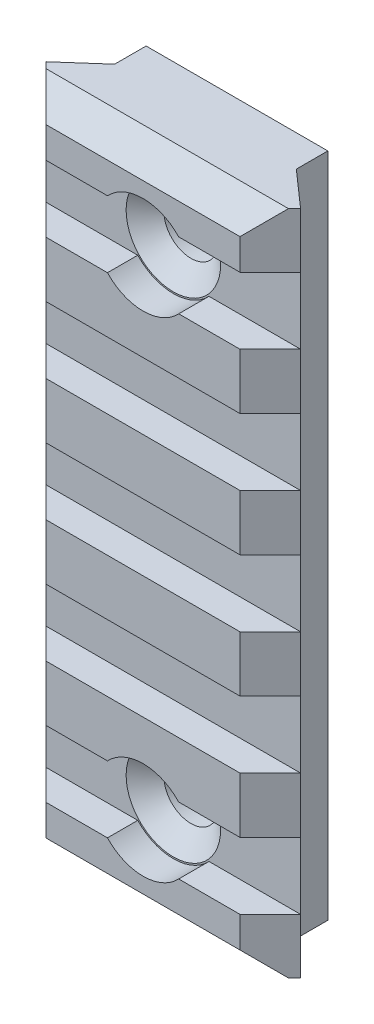
from build123d import *
from OCP.BRepAlgoAPI import BRepAlgoAPI_Cut
from OCP.TopTools import TopTools_ListOfShape

# Parameters (mm, degrees)
EXTRUDE_1_DEPTH          = 55
CUT_EXTRUDE_1_DEPTH      = 57.52709527297507
CUT_EXTRUDE_1_DEPTH_BACK = 57.52709527297507
SKETCH_2_W               = 2.5000000000000018
SKETCH_2_H               = 5.5000000000000036
SKETCH_2_H_2             = 5.499999999999993
SKETCH_2_H_3             = 5.5
CHAMFER_1_SIZE           = 2
SKETCH_3_R               = 1.8999999999999997
SKETCH_3_R_2             = 1.9000000000000001
CUT_EXTRUDE_2_DEPTH      = 57.52709527297507
SKETCH_4_R               = 4.025
CUT_EXTRUDE_3_DEPTH      = 2.5
CUT_EXTRUDE_4_DEPTH      = 3.8
EXTRUDE_START            = -1
EXTRUDE_2_DEPTH          = 1
FILLET_1_R               = 0.1


with BuildPart() as part:
    # 스케치1 → 보스-돌출1 (new body)
    with BuildSketch(Plane(origin=(0, 0, 0), x_dir=(1, 0, 0), z_dir=(0, 1, 0))):
        Polygon((-7.5, 0), (7.5, 0), (7.5, -2.5999999999999983), (10.5, -5.249999999999997), (8.000000000000002, -7.749999999999999), (-7.999999999999998, -7.750000000000001), (-10.5, -5.25), (-7.5, -2.6), align=None)
    extrude(amount=EXTRUDE_1_DEPTH)


with BuildPart() as cut_extrude_1_tool:
    # 스케치2 → 컷-돌출1 (new, two sides: drawn at the far end of the back side and taken through both)
    with BuildSketch(Plane(origin=(0, 0, 0), x_dir=(0, 0, -1), z_dir=(1, 0, 0)).offset(-CUT_EXTRUDE_1_DEPTH_BACK)):
        Polygon((-7.749999999999999, 4.549999999999999), (-5.249999999999997, 4.549999999999999), (-5.249999999999997, 10.049999999999997), (-7.749999999999999, 10.049999999999999), align=None)
        Polygon((-7.749999834765438, 20.150000000000002), (-5.249999834765436, 20.150000000000002), (-5.249999834765436, 14.649999999999999), (-7.749999834765438, 14.65), align=None)
        with Locations((-6.499999669530876, 27.5)):
            Rectangle(SKETCH_2_W, SKETCH_2_H)
        with Locations((-6.499999504296315, 37.599999999999994)):
            Rectangle(SKETCH_2_W, SKETCH_2_H_2)
        with Locations((-6.499999339061754, 47.699999999999996)):
            Rectangle(SKETCH_2_W, SKETCH_2_H_3)
    extrude(amount=CUT_EXTRUDE_1_DEPTH + CUT_EXTRUDE_1_DEPTH_BACK)


with BuildPart() as part_1:
    add(part.part)

    # 컷-돌출1: cut by cut_extrude_1_tool, with a tolerance
    cut_extrude_1_stock = TopTools_ListOfShape()
    cut_extrude_1_stock.Append(part_1.part.wrapped)
    cut_extrude_1_tools = TopTools_ListOfShape()
    cut_extrude_1_tools.Append(cut_extrude_1_tool.part.wrapped)
    cut_extrude_1_cut = BRepAlgoAPI_Cut()
    cut_extrude_1_cut.SetArguments(cut_extrude_1_stock)
    cut_extrude_1_cut.SetTools(cut_extrude_1_tools)
    cut_extrude_1_cut.SetFuzzyValue(0.00001)
    cut_extrude_1_cut.Build()
    add(Compound.cast(cut_extrude_1_cut.Shape()).solids(), mode=Mode.REPLACE)

    # 모따기1
    chamfer_1_edges = [part_1.edges().sort_by_distance(p)[0] for p in [
        (1.78e-15, 55, 7.75),
        (1.78e-15, 0, 7.75),
    ]]
    chamfer(chamfer_1_edges, length=CHAMFER_1_SIZE)

    # 스케치3 → 컷-돌출2 (cut, through all)
    with BuildSketch(Plane.XY):
        with Locations(Location((-3.47e-15, 47.699999999999996, 0), (0, 0, 180))):
            Circle(SKETCH_3_R)
        with Locations(Location((-3.47e-15, 7.299999999999997, 0), (0, 0, 180))):
            Circle(SKETCH_3_R_2)
    extrude(amount=CUT_EXTRUDE_2_DEPTH, mode=Mode.SUBTRACT)

    # 스케치4 → 컷-돌출3 (cut)
    with BuildSketch(Plane.XY.offset(7.75)):
        with Locations((-4.31e-15, 7.299999999999997)):
            Circle(SKETCH_4_R)
        with Locations((-4.31e-15, 47.699999999999996)):
            Circle(SKETCH_4_R)
    extrude(amount=-CUT_EXTRUDE_3_DEPTH, mode=Mode.SUBTRACT)

    # 모따기2
    # the kernel refuses this chamfer: 2, 1.738573476 mm, written as the material it takes off along each edge
    with BuildSketch(Plane(origin=(-3.47e-15, 47.699999999999996, 5.249999339061753), x_dir=(-1, 0, 0), z_dir=(0, -1, 0))) as chamfer_2_piece_1_section:
        with BuildLine():
            Line((3.9603767664178213, -0.05248472231924062), (1.839623233582178, 1.7910581979517))
            Line((1.839623233582178, 1.7910581979517), (1.799623233582178, 1.7910581979517))
            ThreePointArc((1.799623233582178, 1.7910581979517), (1.8599999999999997, 0.8955290989758504), (1.8599999999999997, 0))
            Line((1.8599999999999997, 0), (1.8999999999999997, -0.04000000000000004))
            ThreePointArc((1.8999999999999997, -0.04000000000000004), (2.9301883832089106, -0.04000000000000004), (3.9603767664178213, -0.09248472231924065))
            Line((3.9603767664178213, -0.09248472231924065), (3.9603767664178213, -0.05248472231924062))
        make_face()
    chamfer_2_piece_1 = revolve(axis=Axis((-3.47e-15, 47.699999999999996, 5.249999339061753), (0, 0, -1)), mode=Mode.PRIVATE)
    chamfer_2_piece_1 = split(chamfer_2_piece_1, bisect_by=Plane(origin=(-3.47e-15, 50.449999999999996, 5.249999339061753), z_dir=(0, -1, 0)), keep=Keep.TOP, mode=Mode.PRIVATE)
    chamfer_2_piece_1 = split(chamfer_2_piece_1, bisect_by=Plane(origin=(-3.47e-15, 44.949999999999996, 5.249999339061753), z_dir=(0, 1, 0)), keep=Keep.TOP, mode=Mode.PRIVATE)
    add(chamfer_2_piece_1, mode=Mode.SUBTRACT)
    with BuildSketch(Plane(origin=(-3.47e-15, 47.699999999999996, 5.249999339061753), x_dir=(-1, 0, 0), z_dir=(0, -1, 0))) as chamfer_2_piece_2_section:
        with BuildLine():
            Line((3.9603767664178213, -0.05248472231924062), (1.839623233582178, 1.7910581979517))
            Line((1.839623233582178, 1.7910581979517), (1.799623233582178, 1.7910581979517))
            ThreePointArc((1.799623233582178, 1.7910581979517), (1.8599999999999997, 0.8955290989758504), (1.8599999999999997, 0))
            Line((1.8599999999999997, 0), (1.8999999999999997, -0.04000000000000004))
            ThreePointArc((1.8999999999999997, -0.04000000000000004), (2.9301883832089106, -0.04000000000000004), (3.9603767664178213, -0.09248472231924065))
            Line((3.9603767664178213, -0.09248472231924065), (3.9603767664178213, -0.05248472231924062))
        make_face()
    chamfer_2_piece_2 = revolve(axis=Axis((-3.47e-15, 47.699999999999996, 5.249999339061753), (0, 0, -1)), mode=Mode.PRIVATE)
    chamfer_2_piece_2 = split(chamfer_2_piece_2, bisect_by=Plane(origin=(-3.47e-15, 44.949999999999996, 5.249999339061753), z_dir=(0, -1, 0)), keep=Keep.TOP, mode=Mode.PRIVATE)
    add(chamfer_2_piece_2, mode=Mode.SUBTRACT)
    with BuildSketch(Plane(origin=(-3.47e-15, 47.699999999999996, 5.249999339061753), x_dir=(-1, 0, 0), z_dir=(0, -1, 0))) as chamfer_2_piece_3_section:
        with BuildLine():
            Line((3.9603767664178213, -0.05248472231924062), (1.839623233582178, 1.7910581979517))
            Line((1.839623233582178, 1.7910581979517), (1.799623233582178, 1.7910581979517))
            ThreePointArc((1.799623233582178, 1.7910581979517), (1.8599999999999997, 0.8955290989758504), (1.8599999999999997, 0))
            Line((1.8599999999999997, 0), (1.8999999999999997, -0.04000000000000004))
            ThreePointArc((1.8999999999999997, -0.04000000000000004), (2.9301883832089106, -0.04000000000000004), (3.9603767664178213, -0.09248472231924065))
            Line((3.9603767664178213, -0.09248472231924065), (3.9603767664178213, -0.05248472231924062))
        make_face()
    chamfer_2_piece_3 = revolve(axis=Axis((-3.47e-15, 47.699999999999996, 5.249999339061753), (0, 0, -1)), mode=Mode.PRIVATE)
    chamfer_2_piece_3 = split(chamfer_2_piece_3, bisect_by=Plane(origin=(-3.47e-15, 50.449999999999996, 5.249999339061753), z_dir=(0, 1, 0)), keep=Keep.TOP, mode=Mode.PRIVATE)
    add(chamfer_2_piece_3, mode=Mode.SUBTRACT)
    with BuildSketch(Plane(origin=(-3.47e-15, 7.299999999999997, 5.249999999999997), x_dir=(-1, 0, 0), z_dir=(0, -1, 0))) as chamfer_2_piece_4:
        with BuildLine():
            Line((3.960376766417822, -0.05248472231924062), (1.8396232335821785, 1.7910581979517))
            Line((1.8396232335821785, 1.7910581979517), (1.7996232335821785, 1.7910581979517))
            ThreePointArc((1.7996232335821785, 1.7910581979517), (1.86, 0.8955290989758504), (1.86, 0))
            Line((1.86, 0), (1.9000000000000001, -0.04000000000000004))
            ThreePointArc((1.9000000000000001, -0.04000000000000004), (2.930188383208911, -0.04000000000000004), (3.960376766417822, -0.09248472231924065))
            Line((3.960376766417822, -0.09248472231924065), (3.960376766417822, -0.05248472231924062))
        make_face()
    revolve(axis=Axis((-3.47e-15, 7.299999999999997, 5.249999999999997), (0, 0, -1)), mode=Mode.SUBTRACT)

    # 스케치5 → 컷-돌출4 (cut)
    with BuildSketch(Plane.XY):
        with BuildLine():
            Line((2.95, 50.79999999999999), (2.9500000000000006, 47.699999999999996))
            ThreePointArc((2.9500000000000006, 47.699999999999996), (-4.01e-15, 44.75), (-2.9499999999999997, 47.699999999999996))
            Line((-2.9499999999999997, 47.699999999999996), (-2.95, 50.79999999999999))
            ThreePointArc((-2.95, 50.79999999999999), (1.7e-16, 53.74999999999999), (2.95, 50.79999999999999))
        make_face()
        with BuildLine():
            Line((-2.95, 7.299999999999997), (-2.95, 10.400000000000002))
            ThreePointArc((-2.95, 10.400000000000002), (1.8e-16, 13.350000000000001), (2.95, 10.400000000000002))
            Line((2.95, 10.400000000000002), (2.95, 7.299999999999997))
            ThreePointArc((2.95, 7.299999999999997), (-4.01e-15, 4.3500000000000005), (-2.95, 7.299999999999997))
        make_face()
    extrude(amount=CUT_EXTRUDE_4_DEPTH, mode=Mode.SUBTRACT)

    # 스케치6 → 보스-돌출2 (add)
    with BuildSketch(Plane.XY.offset(EXTRUDE_START)):
        with BuildLine():
            Line((-2.8696028673118352, 11.084017093292044), (-2.8696028673118352, 15.17002285126479))
            ThreePointArc((-2.8696028673118352, 15.17002285126479), (-2.97394354223574, 15.553533335617065), (-3.3160113650873604, 15.75591137943913))
            Line((-3.3160113650873604, 15.75591137943913), (-4.238447681040065, 15.894178508998346))
            ThreePointArc((-4.238447681040065, 15.894178508998346), (-4.485741808137749, 15.986176732767143), (-4.675, 16.17002285126479))
            ThreePointArc((-4.675, 16.17002285126479), (-3.3552259820417296, 19.565361197223766), (0, 20.984017093292046))
            ThreePointArc((0, 20.984017093292046), (3.355225982041729, 19.565361197223766), (4.675, 16.17002285126479))
            ThreePointArc((4.675, 16.17002285126479), (4.485741808137749, 15.986176732767143), (4.238447681040065, 15.894178508998346))
            Line((4.238447681040065, 15.894178508998346), (3.3160113650873604, 15.75591137943913))
            ThreePointArc((3.3160113650873604, 15.75591137943913), (2.9739435422357396, 15.553533335617065), (2.8696028673118352, 15.17002285126479))
            Line((2.8696028673118352, 15.17002285126479), (2.8696028673118352, 11.084017093292044))
            ThreePointArc((2.8696028673118352, 11.084017093292044), (1.8e-16, 13.350000000000001), (-2.8696028673118352, 11.084017093292044))
        make_face()
    extrude(amount=EXTRUDE_2_DEPTH)

    # 필렛1
    fillet_1_edges = [part_1.edges().sort_by_distance(p)[0] for p in [
        (-2.8696028673118352, 11.084017093292044, -0.5),
        (2.8696028673118352, 11.084017093292044, -0.5),
    ]]
    fillet(fillet_1_edges, radius=FILLET_1_R)


solid = part_1.part
